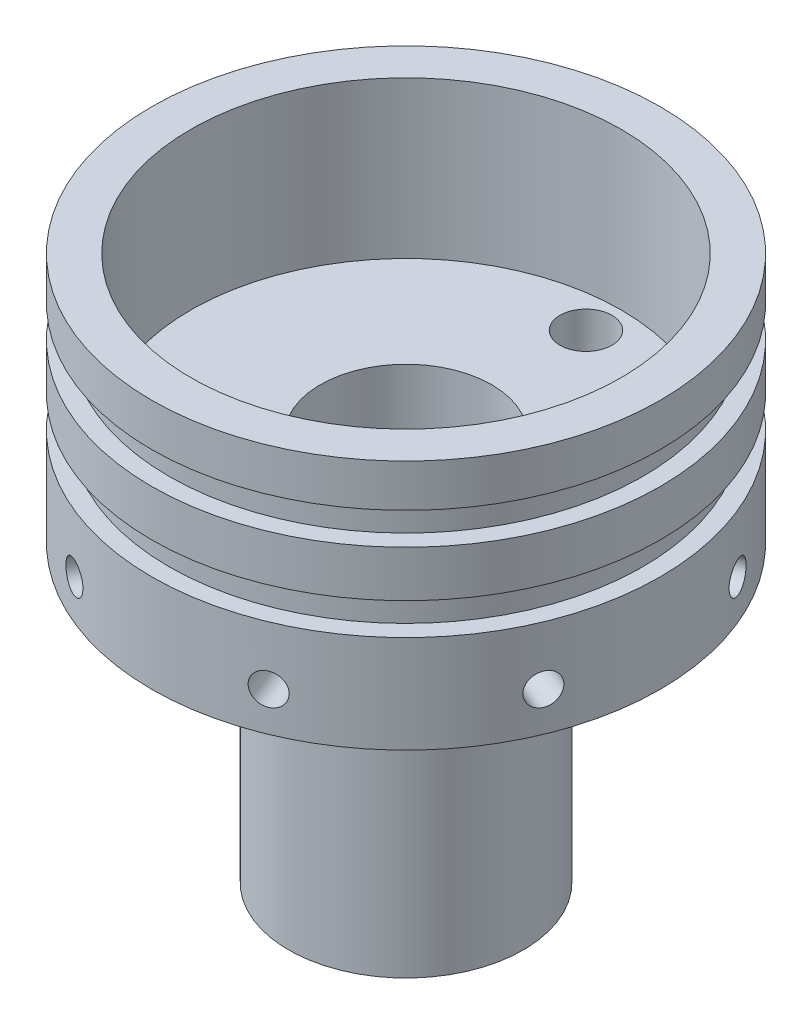
from build123d import *

# Parameters (mm, degrees)
CIRPATTERN1_COUNT        = 8
LPATTERN1_START          = -24.818843944
LPATTERN1_OUTLINE_R      = 41.275
LPATTERN1_OUTLINE_R_2    = 38.453474767
LPATTERN1_DEPTH          = 5.187687888
LPATTERN1_START_2        = -12.118843944
LPATTERN1_2_OUTLINE_R    = 41.275
LPATTERN1_2_OUTLINE_R_2  = 38.453474767
LPATTERN1_2_DEPTH        = 5.187687888
Q_0_332_DIAMETER_HOLE1_D = 8.4328


# Read off the part's stored shape, not the designer's step: LPattern1
with BuildPart() as part:
    # Sketch1 → Revolve1 (revolve)
    with BuildSketch(Plane.XY, mode=Mode.PRIVATE) as revolve1_sk:
        Polygon((-41.275, -40.64), (-41.275, 0), (-34.925, 0), (-34.925, -25.4), (-13.91158, -25.4), (-13.91158, -74.93), (-8.90651, -74.93), (-8.90651, -88.392), (-19.05, -88.392), (-19.05, -40.64), align=None)
    revolve(revolve1_sk.sketch.rotate(Axis((0, 0, 0), (0, 1, 0)), 270), axis=Axis((0, 0, 0), (0, 1, 0)))

    # Sketch8 → 1/4-20 Tapped Hole1 (revolve, cut)
    with BuildSketch(Plane(origin=(38.133127704, -34.29, -15.795258671), x_dir=(-0.38268343236509045, 0, -0.9238795325112865), z_dir=(0, 1, 0))):
        Polygon((0, 0), (0, 20.583816902), (2.5527, 19.05), (2.5527, 0), align=None)
    f_1_4_20_tapped_hole1 = revolve(axis=Axis((43.999762736, -34.29, -18.225298466), (-0.9238795325112865, 0, 0.38268343236509045)), mode=Mode.SUBTRACT)

    # CirPattern1: 1/4-20 Tapped Hole1 ×8 about axis
    cirpattern1_axis = Axis((0, -118.183018713, 0), (0, 1, 0))
    for i in range(1, CIRPATTERN1_COUNT):
        add(f_1_4_20_tapped_hole1.rotate(cirpattern1_axis, i * 360 / CIRPATTERN1_COUNT), mode=Mode.SUBTRACT)

    # LPattern1 outline → LPattern1 (cut)
    with BuildSketch(Plane(origin=(0, 0, 0), x_dir=(1, 0, 0), z_dir=(0, 1, 0)).offset(LPATTERN1_START)):
        Circle(LPATTERN1_OUTLINE_R)
        Circle(LPATTERN1_OUTLINE_R_2, mode=Mode.SUBTRACT)
    extrude(amount=LPATTERN1_DEPTH, mode=Mode.SUBTRACT)

    # LPattern1 2 outline → LPattern1 2 (cut)
    with BuildSketch(Plane(origin=(0, 0, 0), x_dir=(1, 0, 0), z_dir=(0, 1, 0)).offset(LPATTERN1_START_2)):
        Circle(LPATTERN1_2_OUTLINE_R)
        Circle(LPATTERN1_2_OUTLINE_R_2, mode=Mode.SUBTRACT)
    extrude(amount=LPATTERN1_2_DEPTH, mode=Mode.SUBTRACT)

    # Q (0.332) Diameter Hole1 (through all)
    with Locations(Plane(origin=(0, -40.64, 0), x_dir=(-1, 0, 0), z_dir=(0, -1, 0))):
        with Locations((0, 29.21)):
            Hole(Q_0_332_DIAMETER_HOLE1_D / 2)


solid = part.part
